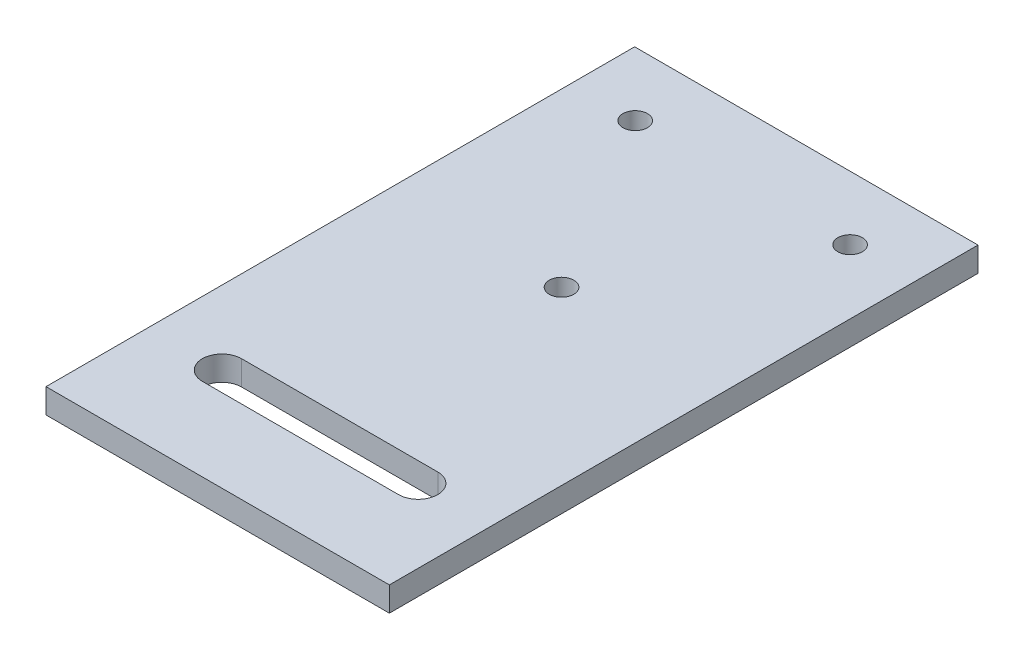
from build123d import *

# Parameters (mm, degrees)
SKETCH1_W           = 70
SKETCH1_H           = 120
SKETCH1_R           = 2.5
BOSS_EXTRUDE1_DEPTH = 5


with BuildPart() as part:
    # Sketch1 → Boss-Extrude1 (new body)
    with BuildSketch(Plane(origin=(0, 0, 0), x_dir=(1, 0, 0), z_dir=(0, 1, 0))):
        with Locations((35, -57.05400982)):
            Rectangle(SKETCH1_W, SKETCH1_H)
        with Locations((13.097845213, -10.034574012)):
            Circle(SKETCH1_R, mode=Mode.SUBTRACT)
        with Locations((56.902154787, -10.034574012)):
            Circle(SKETCH1_R, mode=Mode.SUBTRACT)
        with Locations((35, -46.957253621)):
            Circle(SKETCH1_R, mode=Mode.SUBTRACT)
        with BuildLine():
            Line((15, -92.182185262), (55, -92.182185262))
            ThreePointArc((55, -92.182185262), (59, -96.182185262), (55, -100.182185262))
            Line((55, -100.182185262), (15, -100.182185262))
            ThreePointArc((15, -100.182185262), (11, -96.182185262), (15, -92.182185262))
        make_face(mode=Mode.SUBTRACT)
    extrude(amount=BOSS_EXTRUDE1_DEPTH)


solid = part.part
